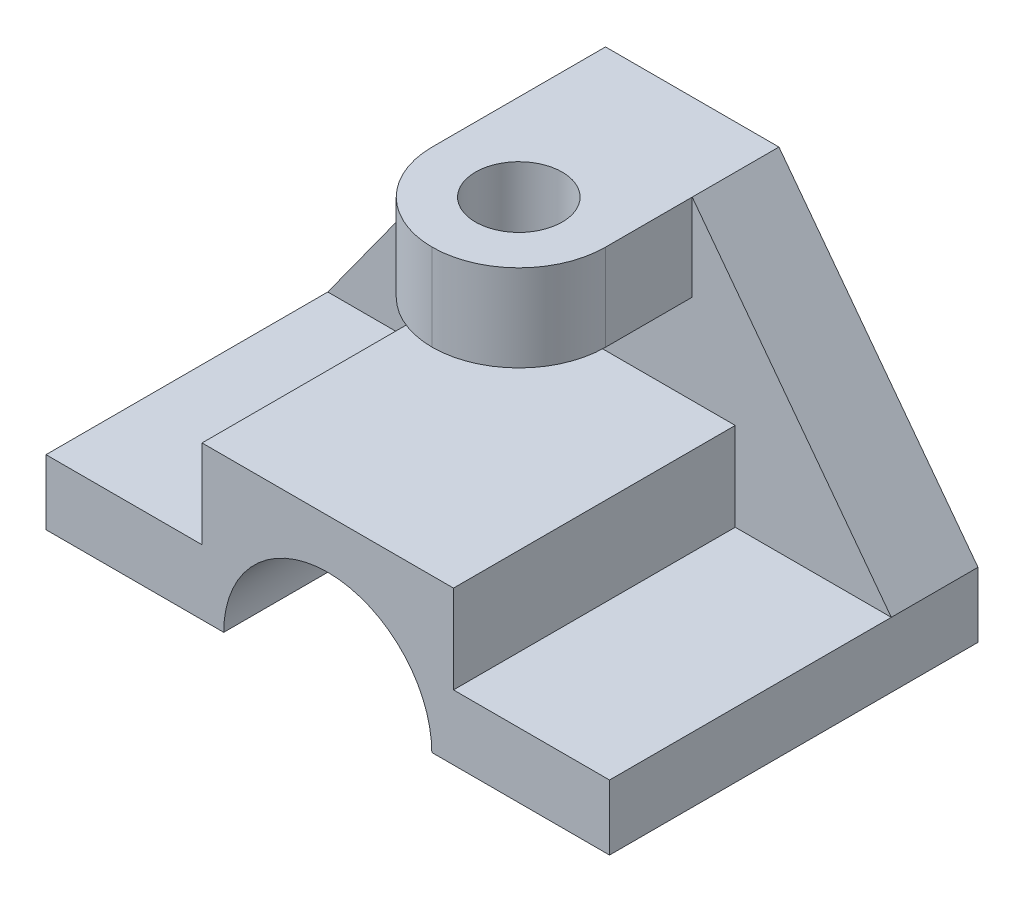
from build123d import *

# Parameters (mm, degrees)
EXTRUDE_2_DEPTH     = 85
EXTRUDE_3_DEPTH     = 20
SKETCH_5_W          = 40
SKETCH_5_H          = 20
EXTRUDE_4_DEPTH     = 40
FILLET_1_R          = 20
SKETCH_6_R          = 10
CUT_EXTRUDE_1_DEPTH = 20


with BuildPart() as part:
    # 스케치1 → 보스-돌출2 (new body)
    with BuildSketch(Plane.XY):
        with BuildLine():
            Line((-24, -15.199619772), (-65, -15.199619772))
            Line((-65, -15.199619772), (-65, -0.199619772))
            Line((-65, -0.199619772), (-29, -0.199619772))
            Line((-29, -0.199619772), (-29, 20.142585551))
            Line((-29, 20.142585551), (29, 20.142585551))
            Line((29, 20.142585551), (29, -0.199619772))
            Line((29, -0.199619772), (65, -0.199619772))
            Line((65, -0.199619772), (65, -15.199619772))
            Line((65, -15.199619772), (24, -15.199619772))
            ThreePointArc((24, -15.199619772), (0, 8.800380228), (-24, -15.199619772))
        make_face()
    extrude(amount=EXTRUDE_2_DEPTH)

    # 스케치4 → 보스-돌출3 (add)
    with BuildSketch(Plane(origin=(0, 0, 0), x_dir=(-1, 0, 0), z_dir=(0, 0, -1))):
        Polygon((-65, -0.199619772), (-29, -0.199619772), (-29, 20.142585551), (29, 20.142585551), (29, -0.199619772), (65, -0.199619772), (20.923247903, 60.800380228), (-19.076752097, 60.800380228), align=None)
    extrude(amount=-EXTRUDE_3_DEPTH)

    # 스케치5 → 보스-돌출4 (add)
    with BuildSketch(Plane.XY.offset(20)):
        with Locations((-0.923247903, 50.800380228)):
            Rectangle(SKETCH_5_W, SKETCH_5_H)
    extrude(amount=EXTRUDE_4_DEPTH)

    # 필렛1
    fillet_1_edges = [part.edges().sort_by_distance(p)[0] for p in [
        (-20.923247903, 50.800380228, 60),
        (19.076752097, 50.800380228, 60),
    ]]
    fillet(fillet_1_edges, radius=FILLET_1_R - 0.0001)  # a hair under: the kernel refuses the full size

    # 스케치6 → 컷-돌출1 (cut)
    with BuildSketch(Plane(origin=(0, 60.800380228, 0), x_dir=(1, 0, 0), z_dir=(0, 1, 0))):
        with Locations(Location((-0.923247903, -40, 0), (0, 0, 180))):
            Circle(SKETCH_6_R)
    extrude(amount=-CUT_EXTRUDE_1_DEPTH, mode=Mode.SUBTRACT)


solid = part.part
